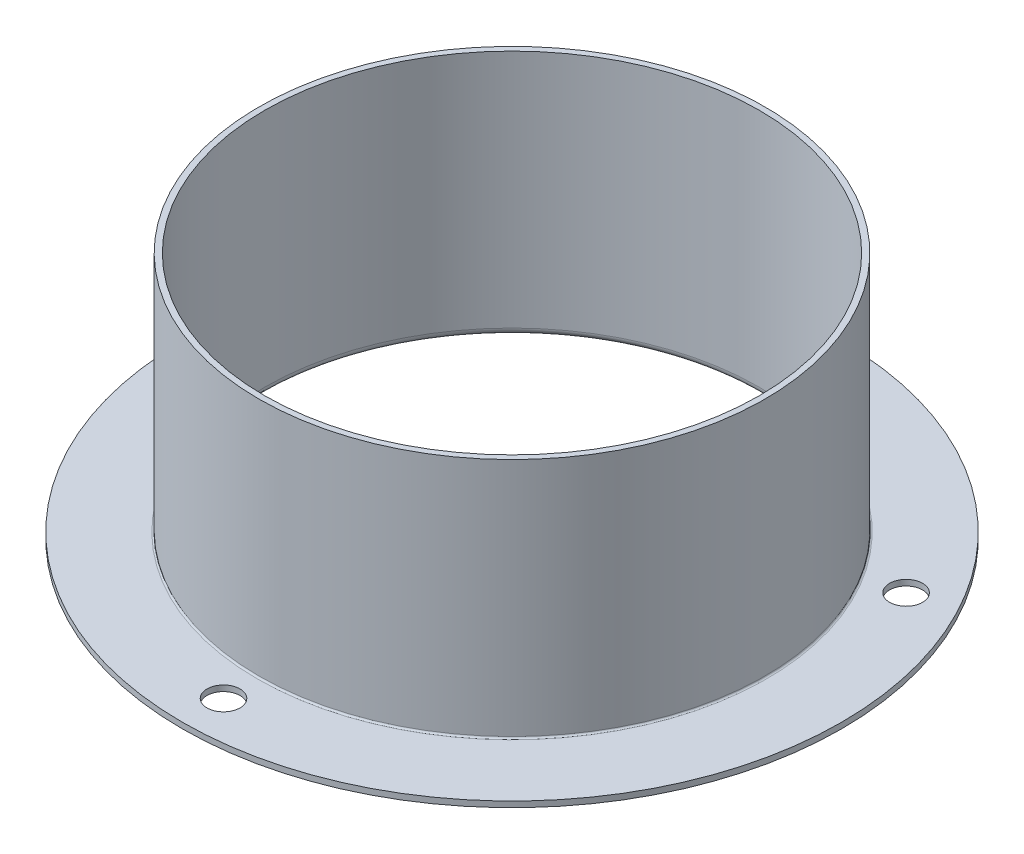
from build123d import *

# Parameters (mm, degrees)
SKETCH_1_R             = 40
SKETCH_1_R_2           = 30
SKETCH_1_R_3           = 2
SM_BASE_FLANGE_1_DEPTH = 0.7


# Read off the part's stored shape, not the designer's step: 边线-法兰2
# Sheet-metal steps are written as plain solids
with BuildPart() as part:
    # Sketch 1 → 基体-法兰1 (new body)
    with BuildSketch(Plane(origin=(0, 0, 0), x_dir=(1, 0, 0), z_dir=(0, 1, 0))):
        with Locations(Location((0, 0, 0), (0, 0, 270))):
            Circle(SKETCH_1_R)
        with Locations(Location((0, 0, 0), (0, 0, 270))):
            Circle(SKETCH_1_R_2, mode=Mode.SUBTRACT)
        with Locations(Location((-30.310889132, 17.5, 0), (0, 0, 270))):
            Circle(SKETCH_1_R_3, mode=Mode.SUBTRACT)
        with Locations(Location((0, -35, 0), (0, 0, 270))):
            Circle(SKETCH_1_R_3, mode=Mode.SUBTRACT)
        with Locations(Location((30.310889132, 17.5, 0), (0, 0, 270))):
            Circle(SKETCH_1_R_3, mode=Mode.SUBTRACT)
    extrude(amount=-SM_BASE_FLANGE_1_DEPTH)

    # 边线-法兰2 outline → 边线-法兰2 (revolve, cut)
    with BuildSketch(Plane.XY):
        with BuildLine():
            Line((30.022503561, 0), (30, 0))
            Line((30, 0), (30, -0.7))
            Line((30, -0.7), (30.9, -0.7))
            ThreePointArc((30.9, -0.7), (30.338751392, -0.503562364), (30.022503561, 0))
        make_face()
    revolve(axis=Axis((0, 0, 0), (0, 1, 0)), mode=Mode.SUBTRACT)

    # Sm Edge Flange 2 2 outline → Sm Edge Flange 2 2 (revolve)
    with BuildSketch(Plane.XY):
        with BuildLine():
            Line((30.7, 29.3), (30, 29.3))
            Line((30, 29.3), (30, 0.2))
            ThreePointArc((30, 0.2), (30.005643585, 0.099368978), (30.022503561, 0))
            Line((30.022503561, 0), (30.9, 0))
            ThreePointArc((30.9, 0), (30.758578644, 0.058578644), (30.7, 0.2))
            Line((30.7, 0.2), (30.7, 29.3))
        make_face()
    revolve(axis=Axis((0, 0, 0), (0, 1, 0)))


solid = part.part
